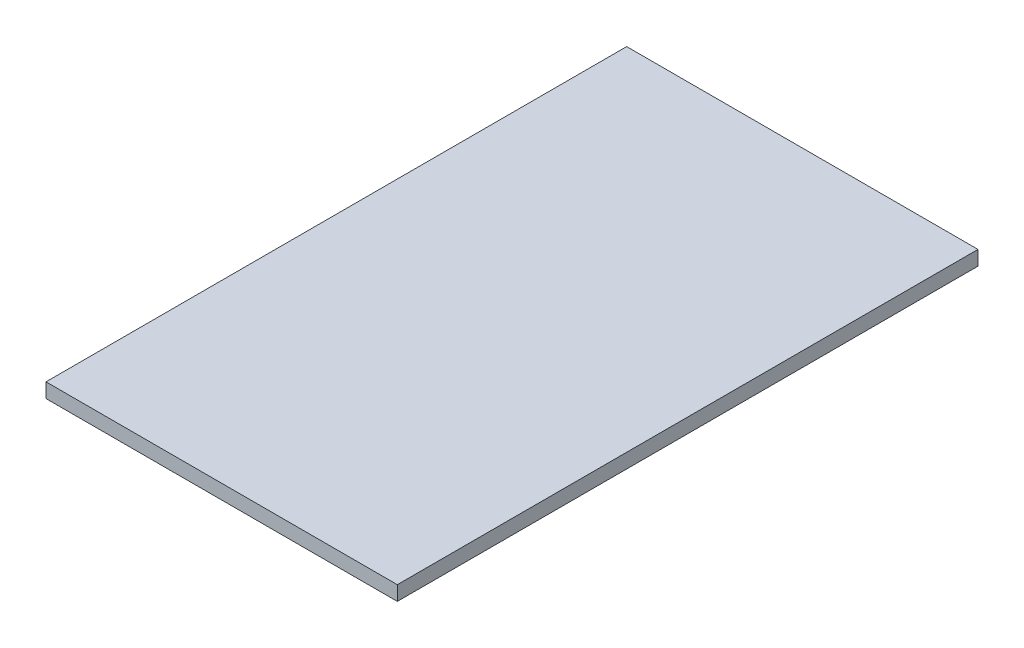
from build123d import *

# Parameters (mm, degrees)
SKETCH_1_W      = 121
SKETCH_1_H      = 200
EXTRUDE_1_DEPTH = 5


with BuildPart() as part:
    # 스케치1 → 보스-돌출1 (new body)
    with BuildSketch(Plane(origin=(0, 0, 0), x_dir=(1, 0, 0), z_dir=(0, 1, 0))):
        Rectangle(SKETCH_1_W, SKETCH_1_H)
    extrude(amount=EXTRUDE_1_DEPTH)


solid = part.part
